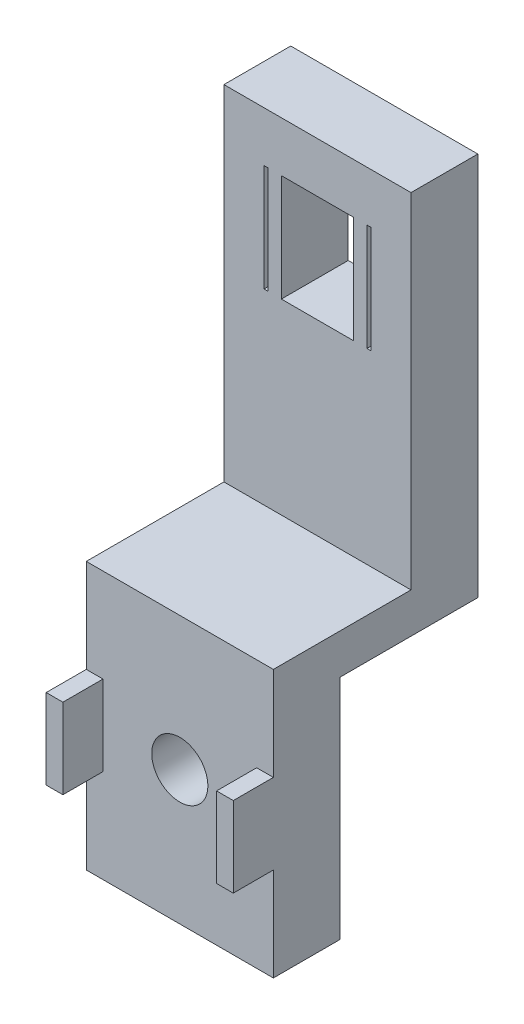
from build123d import *

# Parameters (mm, degrees)
SKETCH1_W           = 14
SKETCH1_H           = 45.75
SKETCH1_W_2         = 5.4
SKETCH1_H_2         = 8
SKETCH1_W_3         = 0.3
SKETCH1_R           = 2.1
BOSS_EXTRUDE3_DEPTH = 15.3
SKETCH2_W           = 10.3
SKETCH2_H           = 17
SKETCH2_H_2         = 25.75
CUT_EXTRUDE1_DEPTH  = 21
SKETCH3_W           = 1.25
SKETCH3_H           = 6
BOSS_EXTRUDE4_DEPTH = 3


with BuildPart() as part:
    # Sketch1 → Boss-Extrude3 (new body)
    with BuildSketch(Plane.XY):
        with Locations((7, 22.875)):
            Rectangle(SKETCH1_W, SKETCH1_H)
        with Locations((7, 38)):
            Rectangle(SKETCH1_W_2, SKETCH1_H_2, mode=Mode.SUBTRACT)
        with Locations((3.15, 38)):
            Rectangle(SKETCH1_W_3, SKETCH1_H_2, mode=Mode.SUBTRACT)
        with Locations((7, 10)):
            Circle(SKETCH1_R, mode=Mode.SUBTRACT)
        with Locations((10.85, 38)):
            Rectangle(SKETCH1_W_3, SKETCH1_H_2, mode=Mode.SUBTRACT)
    extrude(amount=BOSS_EXTRUDE3_DEPTH)

    # Sketch2 → Cut-Extrude1 (cut)
    with BuildSketch(Plane.ZY):
        with Locations((5.15, 8.5)):
            Rectangle(SKETCH2_W, SKETCH2_H)
        with Locations((10.15, 32.875)):
            Rectangle(SKETCH2_W, SKETCH2_H_2)
    extrude(amount=-CUT_EXTRUDE1_DEPTH, mode=Mode.SUBTRACT)

    # Sketch3 → Boss-Extrude4 (add)
    with BuildSketch(Plane.XY.offset(15.3)):
        with Locations((0.625, 10)):
            Rectangle(SKETCH3_W, SKETCH3_H)
        with Locations((13.375, 10)):
            Rectangle(SKETCH3_W, SKETCH3_H)
    extrude(amount=BOSS_EXTRUDE4_DEPTH)


solid = part.part
